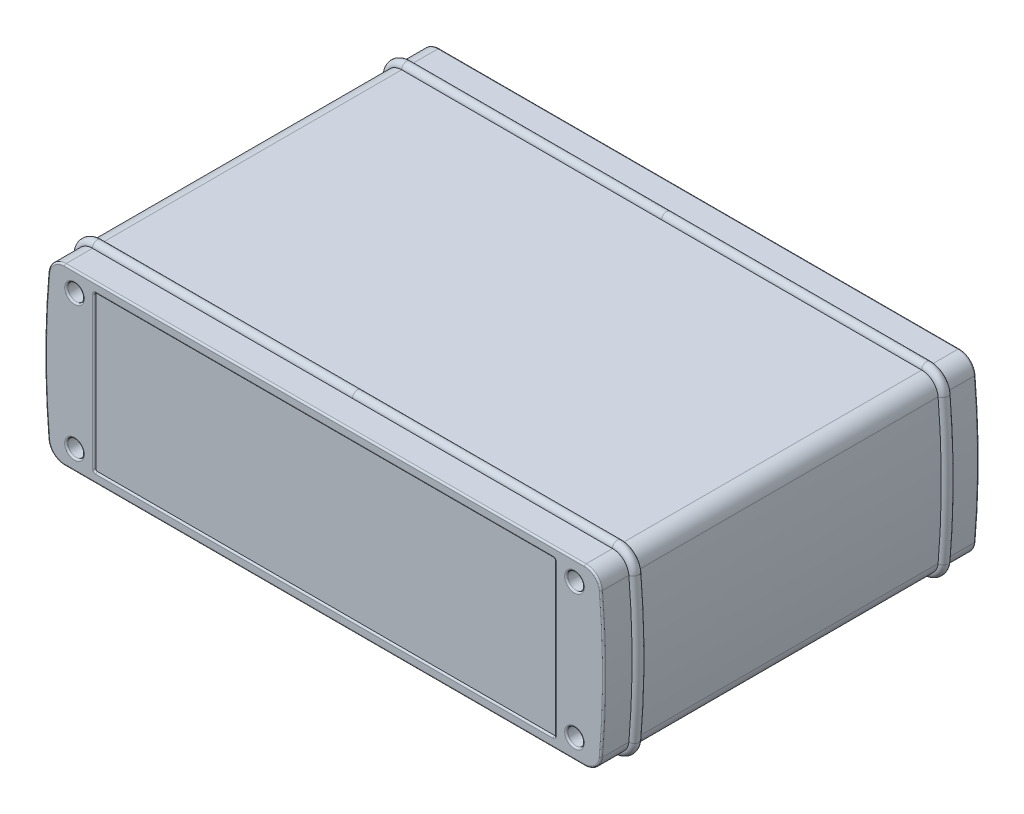
from build123d import *

# Parameters (mm, degrees)
SKETCH1_W               = 172
SKETCH1_H               = 53
BOSS_EXTRUDE1_DEPTH     = 114
CUT_EXTRUDE1_DEPTH      = 214.046943184
FILLET1_R               = 5
SKETCH5_W               = 140
SKETCH5_H               = 47
CUT_EXTRUDE2_DEPTH      = 0.5
FILLET2_R               = 0.5
FILLET3_R               = 0.5
SKETCH6_R               = 2.5
CUT_EXTRUDE3_DEPTH      = 5
MIRROR4_COPY_1_SKETCH_R = 2.5
MIRROR4_COPY_1_DEPTH    = 5
FILLET4_R               = 0.5


with BuildPart() as part:
    # Sketch1 → Boss-Extrude1 (new body)
    with BuildSketch(Plane.XY):
        with Locations((86, 26.5)):
            Rectangle(SKETCH1_W, SKETCH1_H)
    extrude(amount=BOSS_EXTRUDE1_DEPTH)

    # Sketch2 → Cut-Extrude1 (cut, through all)
    with BuildSketch(Plane.XY.offset(114)):
        with BuildLine():
            Line((-106.133621178, 125.317996668), (21.358968095, 125.317996668))
            ThreePointArc((21.358968095, 125.317996668), (1.386909526, 40.403419141), (11.805219162, -46.203898243))
            Line((11.805219162, -46.203898243), (-106.133621178, -46.203898243))
            Line((-106.133621178, -46.203898243), (-106.133621178, 125.317996668))
        make_face()
    cut_extrude1 = extrude(amount=-CUT_EXTRUDE1_DEPTH, mode=Mode.SUBTRACT)

    # Mirror1: Cut-Extrude1 across plane
    add(cut_extrude1.mirror(Plane(origin=(86, 0, 0), x_dir=(0, 0, 1), z_dir=(1, 0, 0))), mode=Mode.SUBTRACT)

    # Fillet1
    fillet1_edges = [part.edges().sort_by_distance(p)[0] for p in [
        (2.408467562, 0, 57),
        (2.408467562, 53, 57),
        (169.591532438, 53, 57),
        (169.591532438, 0, 57),
    ]]
    fillet(fillet1_edges, radius=FILLET1_R)

    # Sweep1: sweep along a path in Sketch3
    with BuildLine(Plane.XY.offset(104)) as sweep1_path:
        Line((6.945190582, 0), (165.054809418, 0))
        ThreePointArc((165.054809418, 0), (168.431651319, 1.312597286), (170.035519814, 4.56122449))
        ThreePointArc((170.035519814, 4.56122449), (171, 26.5), (170.035519814, 48.43877551))
        ThreePointArc((170.035519814, 48.43877551), (168.431651319, 51.687402714), (165.054809418, 53))
        Line((165.054809418, 53), (6.945190582, 53))
        ThreePointArc((6.945190582, 53), (3.568348681, 51.687402714), (1.964480186, 48.43877551))
        ThreePointArc((1.964480186, 48.43877551), (1, 26.5), (1.964480186, 4.56122449))
        ThreePointArc((1.964480186, 4.56122449), (3.568348681, 1.312597286), (6.945190582, 0))
    # Sketch4 → Sweep1 (sweep)
    with BuildSketch(Plane(origin=(86, 0, 0), x_dir=(0, 0, -1), z_dir=(1, 0, 0))):
        with BuildLine():
            Line((-102.5, 53), (-105.5, 53))
            ThreePointArc((-105.5, 53), (-104, 54.5), (-102.5, 53))
        make_face()
    sweep1 = sweep(path=sweep1_path.line)

    # Mirror2: Sweep1 across plane
    add(sweep1.mirror(Plane.XY.offset(57)))

    # Sketch5 → Cut-Extrude2 (cut)
    with BuildSketch(Plane.XY.offset(114)):
        with Locations((86, 26.5)):
            Rectangle(SKETCH5_W, SKETCH5_H)
    extrude(amount=-CUT_EXTRUDE2_DEPTH, mode=Mode.SUBTRACT)

    # Fillet2
    fillet2_edges = [part.edges().sort_by_distance(p)[0] for p in [
        (86, 50, 114),
        (16, 50, 113.75),
        (156, 26.5, 114),
        (156, 50, 113.75),
        (156, 3, 113.75),
        (16, 3, 113.75),
        (16, 26.5, 114),
        (86, 3, 114),
    ]]
    fillet(fillet2_edges, radius=FILLET2_R - 0.0001)  # a hair under: the kernel refuses the full size

    # Fillet3
    fillet3_edges = [part.edges().sort_by_distance(p)[0] for p in [
        (86, 0, 114),
        (86, 0, 0),
        (86, 53, 0),
        (171, 26.5, 0),
        (1, 26.5, 0),
        (3.568348681, 51.687402714, 0),
        (168.431651319, 51.687402714, 0),
        (168.431651319, 1.312597286, 0),
        (3.568348681, 1.312597286, 0),
        (1, 26.5, 114),
        (171, 26.5, 114),
        (86, 53, 114),
        (3.568348681, 51.687402714, 114),
        (168.431651319, 51.687402714, 114),
        (168.431651319, 1.312597286, 114),
        (3.568348681, 1.312597286, 114),
    ]]
    fillet(fillet3_edges, radius=FILLET3_R)

    # Sketch6 → Cut-Extrude3 (cut)
    with BuildSketch(Plane.XY.offset(114)):
        with Locations((10, 47)):
            Circle(SKETCH6_R)
    cut_extrude3 = extrude(amount=-CUT_EXTRUDE3_DEPTH, mode=Mode.SUBTRACT)

    # Mirror3: Cut-Extrude3 across plane
    add(cut_extrude3.mirror(Plane(origin=(86, 0, 0), x_dir=(0, 0, 1), z_dir=(1, 0, 0))), mode=Mode.SUBTRACT)

    # Mirror4: Cut-Extrude3 across plane
    add(cut_extrude3.mirror(Plane.ZX.offset(26.5)), mode=Mode.SUBTRACT)

    # Mirror4 copy 1 sketch → Mirror4 copy 1 (cut)
    with BuildSketch(Plane(origin=(172, 53, 114), x_dir=(-1, 0, 0), z_dir=(0, 0, 1))):
        with Locations((10, 47)):
            Circle(MIRROR4_COPY_1_SKETCH_R)
    extrude(amount=-MIRROR4_COPY_1_DEPTH, mode=Mode.SUBTRACT)

    # Fillet4
    fillet4_edges = [part.edges().sort_by_distance(p)[0] for p in [
        (7.5, 47, 114),
        (164.5, 47, 114),
        (7.5, 6, 114),
        (164.5, 6, 114),
    ]]
    fillet(fillet4_edges, radius=FILLET4_R)


solid = part.part
